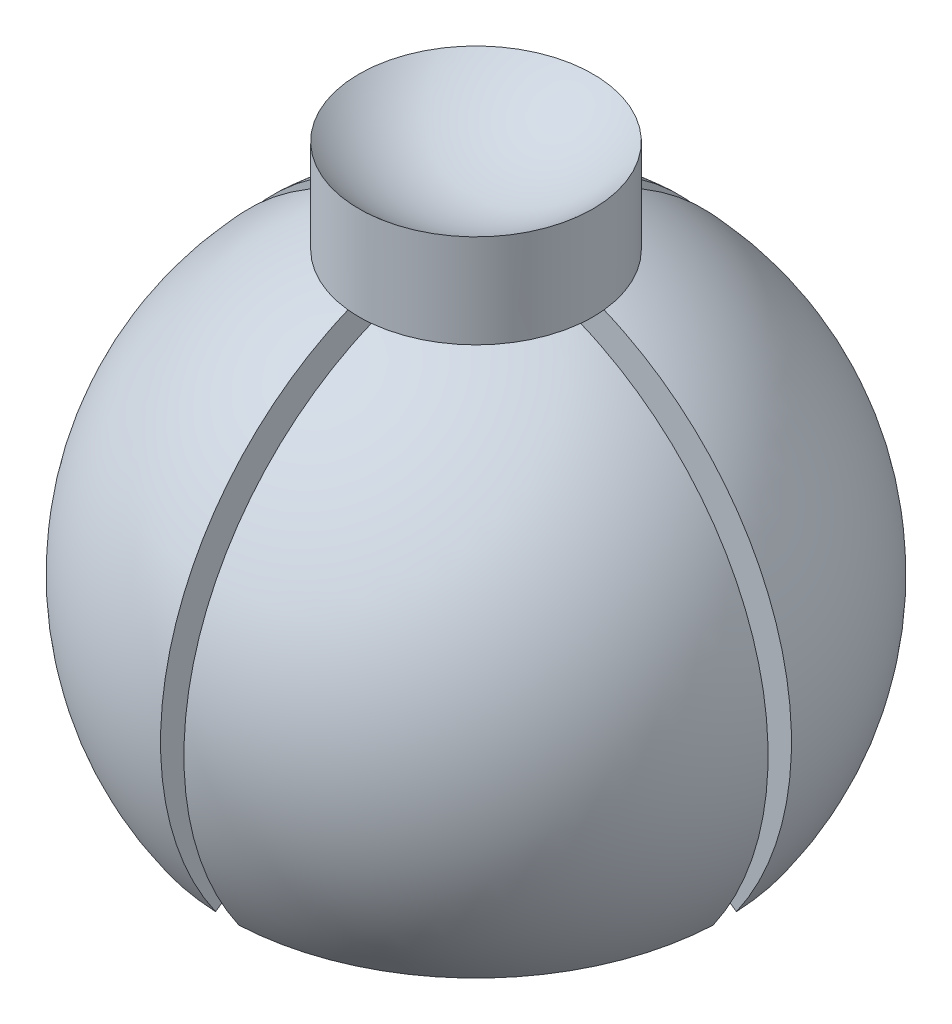
from build123d import *

# Parameters (mm, degrees)
SKETCH2_W          = 0.5
SKETCH2_H          = 9.728246836
CUT_EXTRUDE1_DEPTH = 10
CIRPATTERN1_COUNT  = 4


with BuildPart() as part:
    # Sketch1 → Revolve1 (revolve)
    with BuildSketch(Plane.XY):
        with BuildLine():
            Line((0, 7), (0, 5))
            ThreePointArc((0, 5), (4.435054166, 2.308743066), (4.095760221, -2.867882182))
            Line((4.095760221, -2.867882182), (5.324488288, -3.728246836))
            ThreePointArc((5.324488288, -3.728246836), (6.242223231, 1.8123601), (2.5, 6))
            Line((2.5, 6), (2.5, 8))
            ThreePointArc((2.5, 8), (1.346291202, 7.259271996), (0, 7))
        make_face()
    revolve(axis=Axis((0, 7, 0), (0, -1, 0)))

    # Sketch2 → Cut-Extrude1 (cut)
    with BuildSketch(Plane.XY):
        with Locations((0, 1.135876582)):
            Rectangle(SKETCH2_W, SKETCH2_H)
    cut_extrude1 = extrude(amount=-CUT_EXTRUDE1_DEPTH, mode=Mode.SUBTRACT)

    # CirPattern1: Cut-Extrude1 ×4 about axis
    cirpattern1_axis = Axis((0, -3.728246836, 0), (0, 1, 0))
    for i in range(1, CIRPATTERN1_COUNT):
        add(cut_extrude1.rotate(cirpattern1_axis, i * 360 / CIRPATTERN1_COUNT), mode=Mode.SUBTRACT)


solid = part.part
